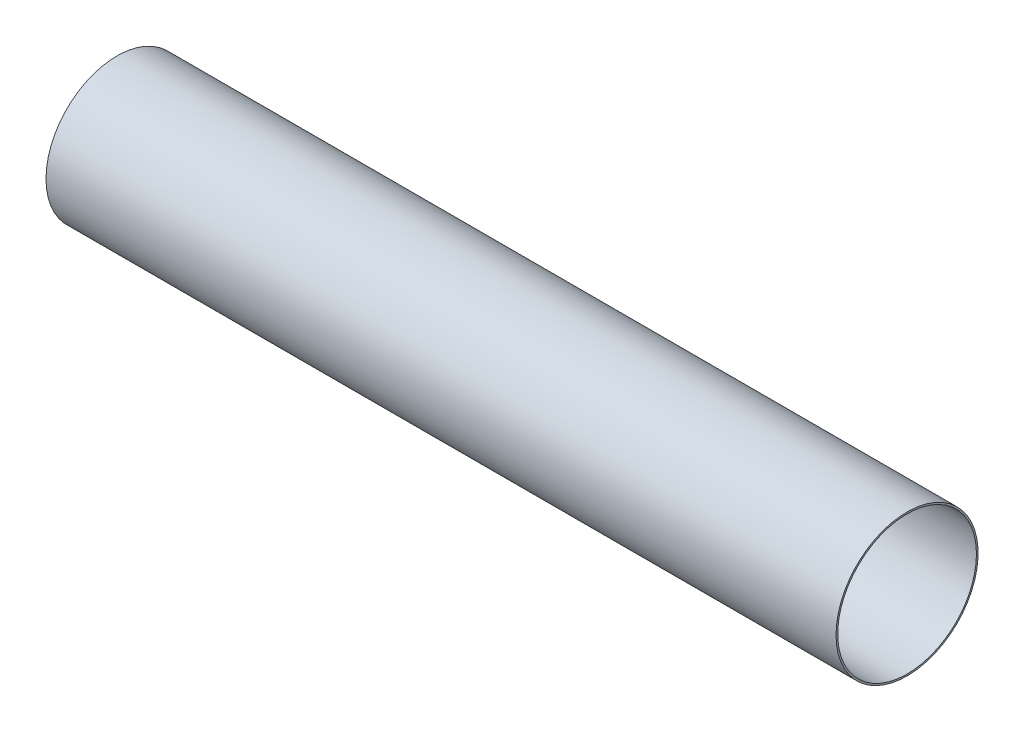
from build123d import *

# Parameters (mm, degrees)
SKETCH1_R           = 84.55
BOSS_EXTRUDE2_DEPTH = 940
SKETCH3_R           = 82.55
CUT_EXTRUDE1_DEPTH  = 940


with BuildPart() as part:
    # Sketch1 → Boss-Extrude2 (new body)
    with BuildSketch(Plane(origin=(0, 0, 0), x_dir=(0, 0, -1), z_dir=(1, 0, 0))):
        Circle(SKETCH1_R)
    extrude(amount=BOSS_EXTRUDE2_DEPTH)

    # Sketch3 → Cut-Extrude1 (cut)
    with BuildSketch(Plane(origin=(940, 0, 0), x_dir=(0, 0, -1), z_dir=(1, 0, 0))):
        Circle(SKETCH3_R)
    extrude(amount=-CUT_EXTRUDE1_DEPTH, mode=Mode.SUBTRACT)


solid = part.part
